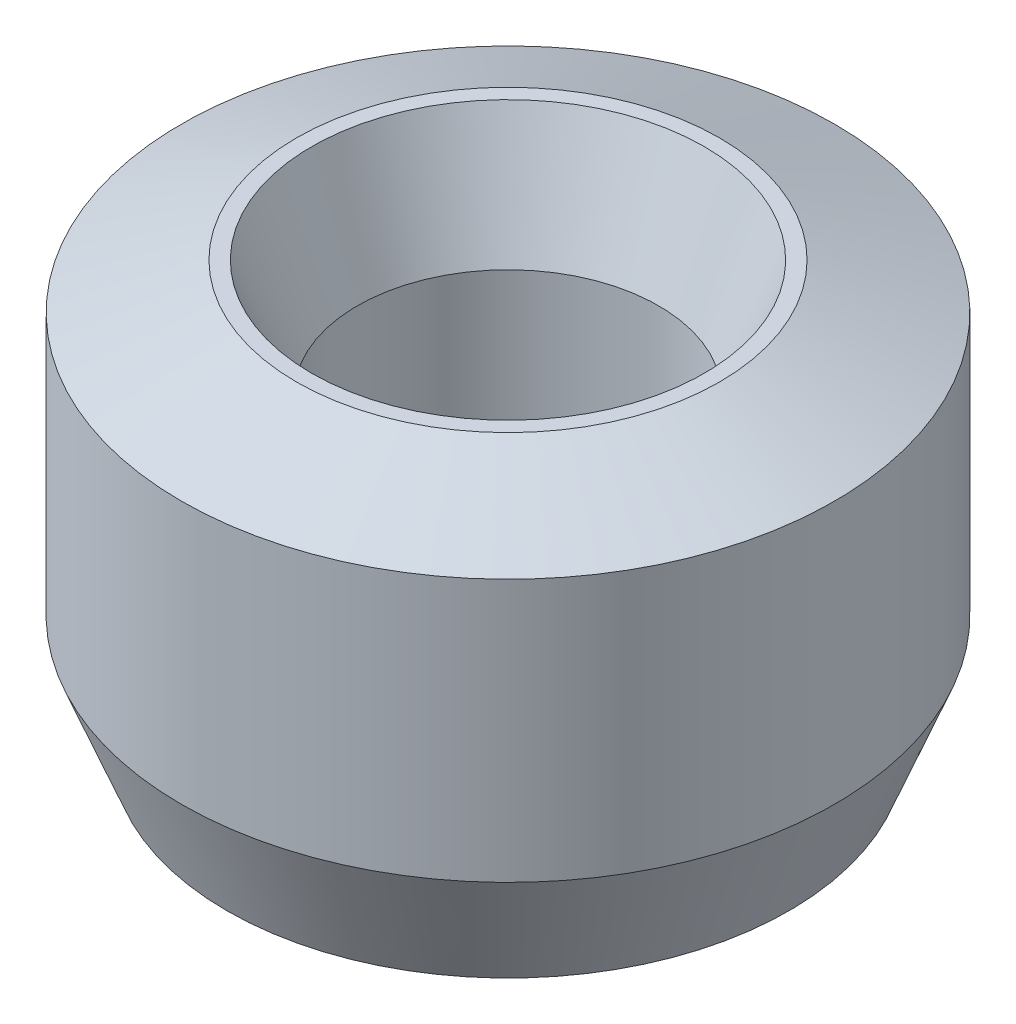
from build123d import *
from OCP.BRepFilletAPI import BRepFilletAPI_MakeChamfer

# Parameters (mm, degrees)
SKETCH1_R           = 27.5
BOSS_EXTRUDE1_DEPTH = 35.641181065
SKETCH2_R           = 12.693295933
CUT_EXTRUDE1_DEPTH  = 53.752192255
CHAMFER1_SIZE       = 3.840419456
CHAMFER1_SIZE2      = 9.690757933


with BuildPart() as part:
    # Sketch1 → Boss-Extrude1 (new body)
    with BuildSketch(Plane(origin=(0, 0, 0), x_dir=(1, 0, 0), z_dir=(0, 1, 0))):
        Circle(SKETCH1_R)
    extrude(amount=BOSS_EXTRUDE1_DEPTH)

    # Sketch2 → Cut-Extrude1 (cut, through all)
    with BuildSketch(Plane(origin=(0, 0, 0), x_dir=(1, 0, 0), z_dir=(0, 1, 0))):
        Circle(SKETCH2_R)
    extrude(amount=CUT_EXTRUDE1_DEPTH, mode=Mode.SUBTRACT)

    # Chamfer1: one chamfer whose edges measure the first distance from different faces: ONE call of the kernel's chamfer builder (chamfer() names one face for all edges)
    chamfer1_edges_1 = [part.edges().sort_by_distance(p)[0] for p in [
        (-12.693295933, 35.641181065, 0),
    ]]
    chamfer1_side_1 = [part.faces().sort_by_distance(p)[0] for p in [
        (-26.722182541, 35.641181065, 0),
    ]]
    chamfer1_edges_2 = [part.edges().sort_by_distance(p)[0] for p in [
        (-12.693295933, 0, 0),
    ]]
    chamfer1_side_2 = [part.faces().sort_by_distance(p)[0] for p in [
        (-12.693295933, 17.820590532, 0),
    ]]
    chamfer1_edges_3 = [part.edges().sort_by_distance(p)[0] for p in [
        (-27.5, 0, 0),
    ]]
    chamfer1_side_3 = [part.faces().sort_by_distance(p)[0] for p in [
        (-26.722182541, 0, 0),
    ]]
    chamfer1_edges_4 = [part.edges().sort_by_distance(p)[0] for p in [
        (-27.5, 35.641181065, 0),
    ]]
    chamfer1_side_4 = [part.faces().sort_by_distance(p)[0] for p in [
        (-27.5, 17.820590532, 0),
    ]]
    chamfer1 = BRepFilletAPI_MakeChamfer(part.part.solid().wrapped)
    for e in chamfer1_edges_1:
        chamfer1.Add(CHAMFER1_SIZE, CHAMFER1_SIZE2, e.wrapped, chamfer1_side_1[0].wrapped)  # the first distance lies on this face
    for e in chamfer1_edges_2:
        chamfer1.Add(CHAMFER1_SIZE, CHAMFER1_SIZE2, e.wrapped, chamfer1_side_2[0].wrapped)  # the first distance lies on this face
    for e in chamfer1_edges_3:
        chamfer1.Add(CHAMFER1_SIZE, CHAMFER1_SIZE2, e.wrapped, chamfer1_side_3[0].wrapped)  # the first distance lies on this face
    for e in chamfer1_edges_4:
        chamfer1.Add(CHAMFER1_SIZE, CHAMFER1_SIZE2, e.wrapped, chamfer1_side_4[0].wrapped)  # the first distance lies on this face
    add(Compound.cast(chamfer1.Shape()), mode=Mode.REPLACE)


solid = part.part
